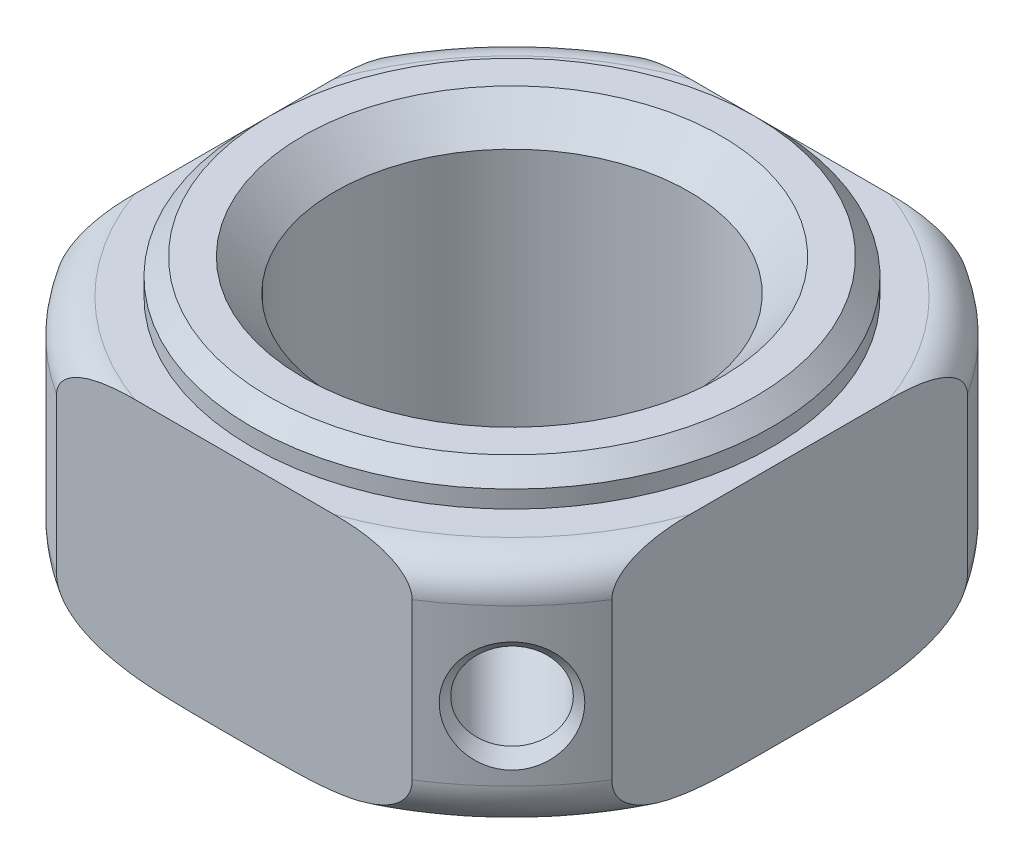
from build123d import *

# Parameters (mm, degrees)
RESSALTO_EXTRUS_O1_DEPTH         = 7
ESBO_O2_R                        = 7.5
RESSALTO_EXTRUS_O2_DEPTH         = 1
FURO_ROSCADO_DE_M121_D           = 10.2
FURO_ROSCADO_DE_M121_CSINK_D     = 12.05
FURO_ROSCADO_DE_M121_CSINK_ANGLE = 90
FILETE1_R                        = 1
FILETE2_R                        = 1.5
CHANFRO1_SIZE                    = 0.5


# Read off the part's stored shape, not the designer's step: Furo roscado de M32
with BuildPart() as part:
    # Esboço1 → Ressalto-extrusão1 (new body)
    with BuildSketch(Plane(origin=(0, 0, 0), x_dir=(1, 0, 0), z_dir=(0, 1, 0))):
        with BuildLine():
            Line((5.123475383, 8), (-5.123475383, 8))
            ThreePointArc((-5.123475383, 8), (-6.717514421, 6.717514421), (-8, 5.123475383))
            Line((-8, 5.123475383), (-8, -5.123475383))
            ThreePointArc((-8, -5.123475383), (-6.717514421, -6.717514421), (-5.123475383, -8))
            Line((-5.123475383, -8), (5.123475383, -8))
            ThreePointArc((5.123475383, -8), (6.717514421, -6.717514421), (8, -5.123475383))
            Line((8, -5.123475383), (8, 5.123475383))
            ThreePointArc((8, 5.123475383), (6.717514421, 6.717514421), (5.123475383, 8))
        make_face()
    extrude(amount=RESSALTO_EXTRUS_O1_DEPTH)

    # Esboço2 → Ressalto-extrusão2 (add)
    with BuildSketch(Plane(origin=(0, 7, 0), x_dir=(1, 0, 0), z_dir=(0, 1, 0))):
        with Locations(Location((0, 0, 0), (0, 0, 270))):
            Circle(ESBO_O2_R)
    extrude(amount=RESSALTO_EXTRUS_O2_DEPTH)

    # Furo roscado de M121 (through all)
    with Locations(Plane(origin=(0, 8, 0), x_dir=(1, 0, 0), z_dir=(0, 1, 0))):
        with Locations((0, 0)):
            CounterSinkHole(FURO_ROSCADO_DE_M121_D / 2, FURO_ROSCADO_DE_M121_CSINK_D / 2, counter_sink_angle=FURO_ROSCADO_DE_M121_CSINK_ANGLE)

    # Filete1
    filete1_edges = [part.edges().sort_by_distance(p)[0] for p in [
        (6.717514421, 7, 6.717514421),
        (6.717514421, 7, -6.717514421),
        (-6.717514421, 7, -6.717514421),
        (-6.717514421, 7, 6.717514421),
    ]]
    fillet(filete1_edges, radius=FILETE1_R)

    # Filete2
    filete2_edges = [part.edges().sort_by_distance(p)[0] for p in [
        (6.717514421, 0, -6.717514421),
        (-6.717514421, 0, -6.717514421),
        (-6.717514421, 0, 6.717514421),
        (6.717514421, 0, 6.717514421),
    ]]
    fillet(filete2_edges, radius=FILETE2_R - 0.0001)  # a hair under: the kernel refuses the full size

    # Chanfro1
    chanfro1_edges = [part.edges().sort_by_distance(p)[0] for p in [
        (0, 8, -7.5),
    ]]
    chamfer(chanfro1_edges, length=CHANFRO1_SIZE)

    # Furo roscado de M32 outline → Furo roscado de M32 (revolve, cut)
    with BuildSketch(Plane(origin=(0, 3.5, 0), x_dir=(0.707106781186546, 0, -0.707106781186549), z_dir=(0, -1, 0))):
        Polygon((1.600067365, 9.500067365), (0, 9.500067365), (0, 4.944353867), (1.25, 4.944353867), (1.25, 9.15), align=None)
    revolve(axis=Axis((0, 3.5, 0), (0.707106781186549, 0, 0.707106781186546)), mode=Mode.SUBTRACT)


solid = part.part
